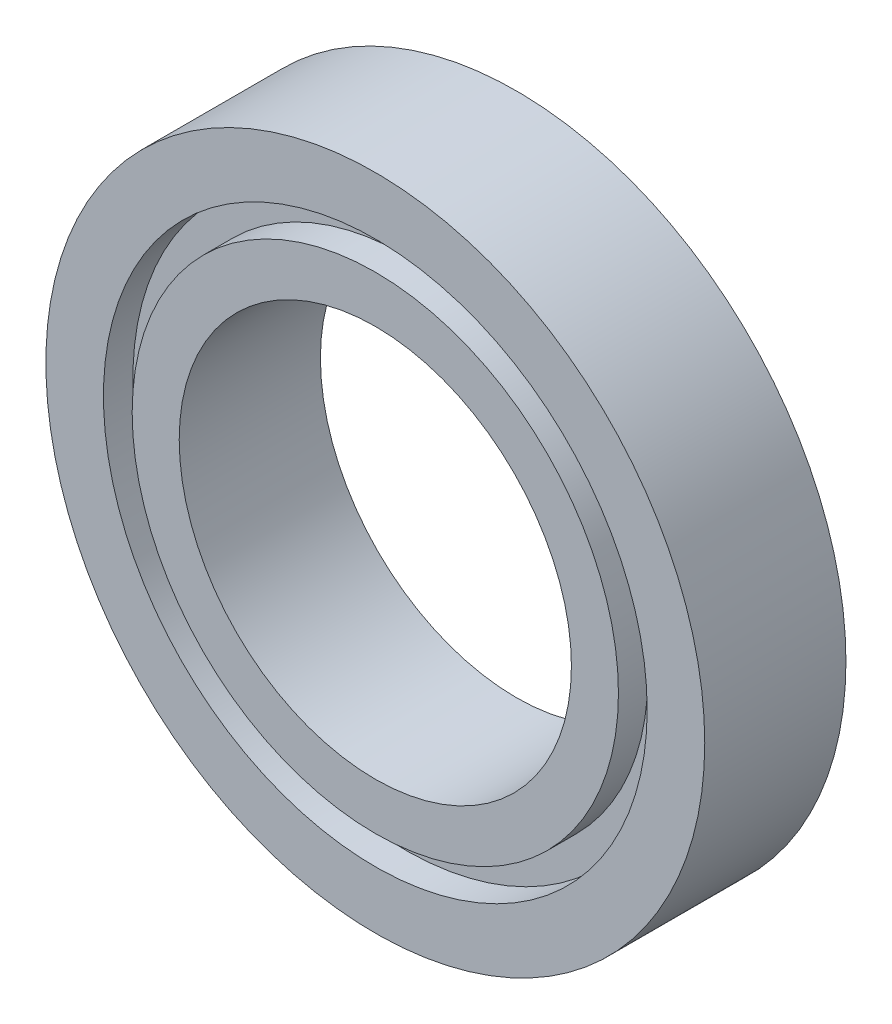
from build123d import *

# Parameters (mm, degrees)
SKETCH_1_R      = 21
SKETCH_1_R_2    = 12.5
EXTRUDE_1_DEPTH = 4.5
SKETCH_5_W      = 1.875649264
SKETCH_5_H      = 1.832016606


with BuildPart() as part:
    # 草图1 → 凸台-拉伸1 (new, symmetric)
    with BuildSketch(Plane.XY):
        Circle(SKETCH_1_R)
        Circle(SKETCH_1_R_2, mode=Mode.SUBTRACT)
    extrude(amount=EXTRUDE_1_DEPTH, both=True)

    # 草图5 → 切除-旋转1 (revolve, cut)
    with BuildSketch(Plane(origin=(0, 0, 0), x_dir=(0, 0, -1), z_dir=(1, 0, 0))):
        with Locations((-3.562175368, 16.414104413)):
            Rectangle(SKETCH_5_W, SKETCH_5_H)
        with Locations((3.562175368, 16.414104413)):
            Rectangle(SKETCH_5_W, SKETCH_5_H)
    revolve(axis=Axis((0, 0, 0), (0, 0, -1)), mode=Mode.SUBTRACT)


solid = part.part
